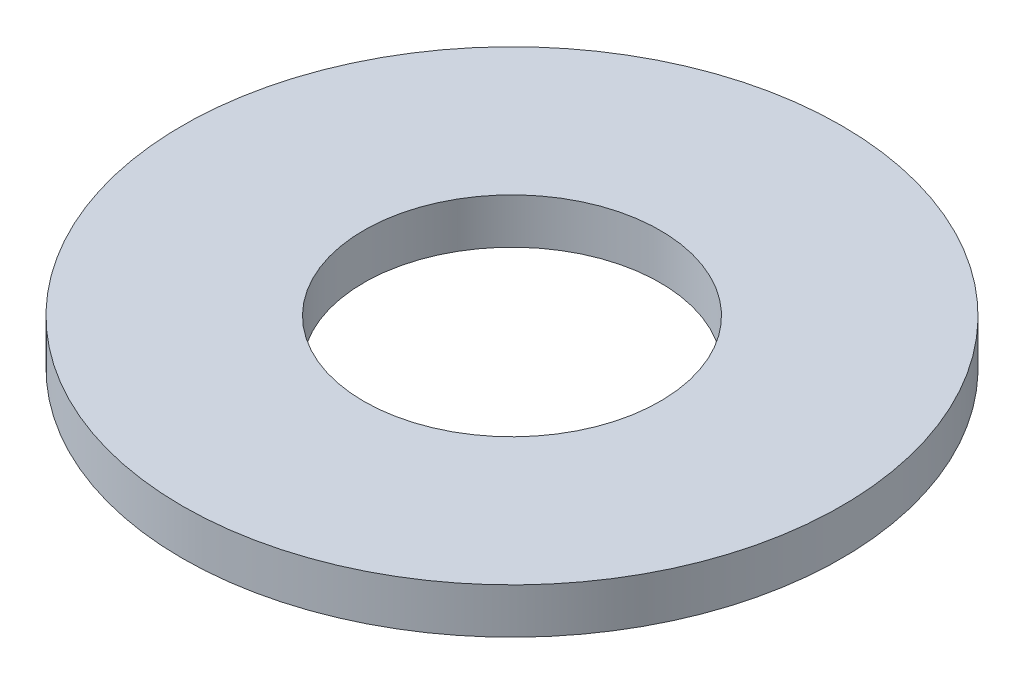
from build123d import *

# Parameters (mm, degrees)
SKETCH1_R           = 7.9375
BOSS_EXTRUDE1_DEPTH = 1.0922
SKETCH5_R           = 3.5687
CUT_EXTRUDE1_DEPTH  = 12.278329368


with BuildPart() as part:
    # Sketch1 → Boss-Extrude1 (new body)
    with BuildSketch(Plane(origin=(0, 0, 0), x_dir=(1, 0, 0), z_dir=(0, 1, 0))):
        Circle(SKETCH1_R)
    extrude(amount=BOSS_EXTRUDE1_DEPTH)

    # Sketch5 → Cut-Extrude1 (cut, through all)
    with BuildSketch(Plane(origin=(0, 1.0922, 0), x_dir=(-1, 0, 0), z_dir=(0, 1, 0))):
        Circle(SKETCH5_R)
    extrude(amount=-CUT_EXTRUDE1_DEPTH, mode=Mode.SUBTRACT)


solid = part.part
